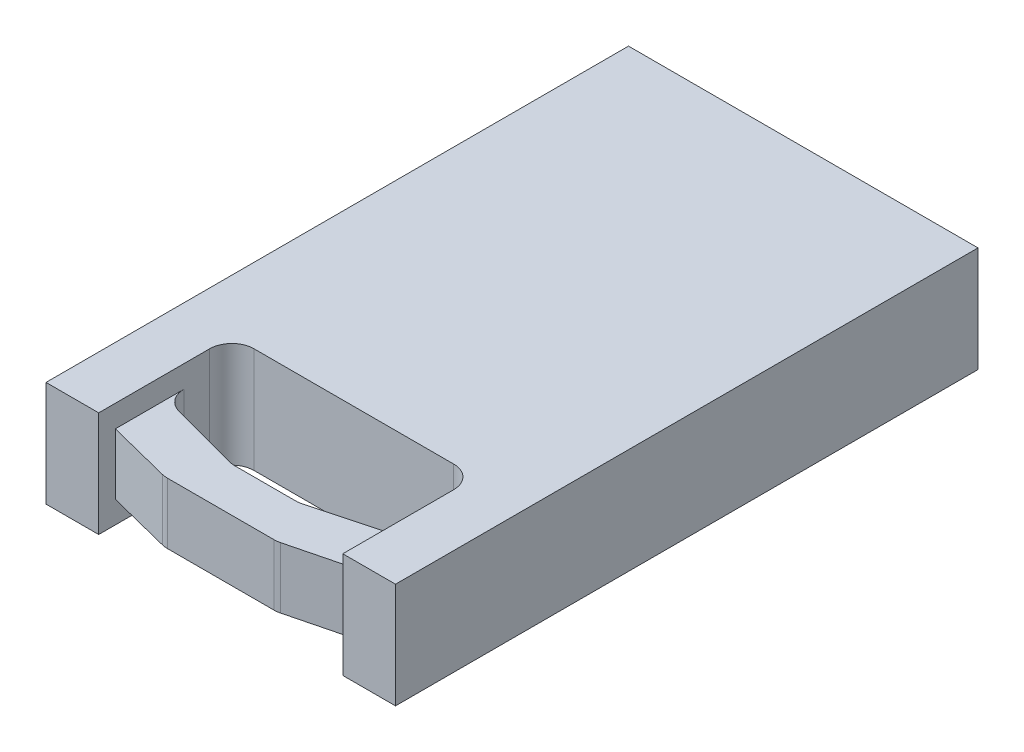
from build123d import *

# Parameters (mm, degrees)
SKETCH1_W           = 419.1
SKETCH1_H           = 333.375
BOSS_EXTRUDE1_DEPTH = 60.325
SKETCH2_W           = 139.7
SKETCH2_H           = 50.8
CUT_EXTRUDE1_DEPTH  = 275.47227689
CHAMFER1_SIZE       = 50.8
CHAMFER1_SIZE2      = 13.611818976
FILLET1_R           = 12.7
SKETCH3_W           = 139.7
SKETCH3_H           = 56.403006085
CUT_EXTRUDE2_DEPTH  = 12.7
SKETCH4_W           = 139.7
SKETCH4_H           = 56.128435861
CUT_EXTRUDE3_DEPTH  = 12.7
SKETCH5_OUTSIDE_W   = 528.882
SKETCH5_OUTSIDE_H   = 443.156
SKETCH5_OUTSIDE_W_2 = 200.025
SKETCH5_OUTSIDE_H_2 = 333.375
CUT_EXTRUDE4_DEPTH  = 275.47227689


with BuildPart() as part:
    # Sketch1 → Boss-Extrude1 (new body)
    with BuildSketch(Plane(origin=(0, 0, 0), x_dir=(1, 0, 0), z_dir=(0, 1, 0))):
        Rectangle(SKETCH1_W, SKETCH1_H)
    extrude(amount=BOSS_EXTRUDE1_DEPTH)

    # Sketch2 → Cut-Extrude1 (cut, through all)
    with BuildSketch(Plane(origin=(0, 60.325, 0), x_dir=(1, 0, 0), z_dir=(0, 1, 0))):
        with Locations((0, -115.8875)):
            Rectangle(SKETCH2_W, SKETCH2_H)
        Polygon((-69.85, -166.6875), (-69.85, -157.1625), (-32.169017961, -166.6875), align=None)
        Polygon((32.169017961, -166.6875), (69.85, -166.6875), (69.85, -157.1625), align=None)
    extrude(amount=-CUT_EXTRUDE1_DEPTH, mode=Mode.SUBTRACT)

    # Chamfer1
    chamfer1_edges = [part.edges().sort_by_distance(p)[0] for p in [
        (69.85, 30.1625, 141.2875),
        (-69.85, 30.1625, 141.2875),
    ]]
    chamfer1_side = [part.faces().sort_by_distance(p)[0] for p in [
        (0, 30.1625, 141.2875),
    ]]
    chamfer(chamfer1_edges, length=CHAMFER1_SIZE, length2=CHAMFER1_SIZE2, reference=chamfer1_side[0])

    # Fillet1
    fillet1_edges = [part.edges().sort_by_distance(p)[0] for p in [
        (32.169017961, 30.1625, 166.6875),
        (-32.169017961, 30.1625, 166.6875),
        (69.85, 30.1625, 127.675681024),
        (19.05, 30.1625, 141.2875),
        (-19.05, 30.1625, 141.2875),
        (-69.85, 30.1625, 127.675681024),
        (69.85, 30.1625, 90.4875),
        (-69.85, 30.1625, 90.4875),
    ]]
    fillet(fillet1_edges, radius=FILLET1_R)

    # Sketch3 → Cut-Extrude2 (cut)
    with BuildSketch(Plane(origin=(0, 60.325, 0), x_dir=(1, 0, 0), z_dir=(0, 1, 0))):
        with Locations((0, -138.485996957)):
            Rectangle(SKETCH3_W, SKETCH3_H)
    extrude(amount=-CUT_EXTRUDE2_DEPTH, mode=Mode.SUBTRACT)

    # Sketch4 → Cut-Extrude3 (cut)
    with BuildSketch(Plane.XZ):
        with Locations((0, 138.623282069)):
            Rectangle(SKETCH4_W, SKETCH4_H)
    extrude(amount=-CUT_EXTRUDE3_DEPTH, mode=Mode.SUBTRACT)

    # Sketch5 outside → Cut-Extrude4 (cut, through all)
    with BuildSketch(Plane(origin=(0, 60.325, 0), x_dir=(1, 0, 0), z_dir=(0, 1, 0))):
        Rectangle(SKETCH5_OUTSIDE_W, SKETCH5_OUTSIDE_H)
        Rectangle(SKETCH5_OUTSIDE_W_2, SKETCH5_OUTSIDE_H_2, mode=Mode.SUBTRACT)
    extrude(amount=-CUT_EXTRUDE4_DEPTH, mode=Mode.SUBTRACT)


solid = part.part
